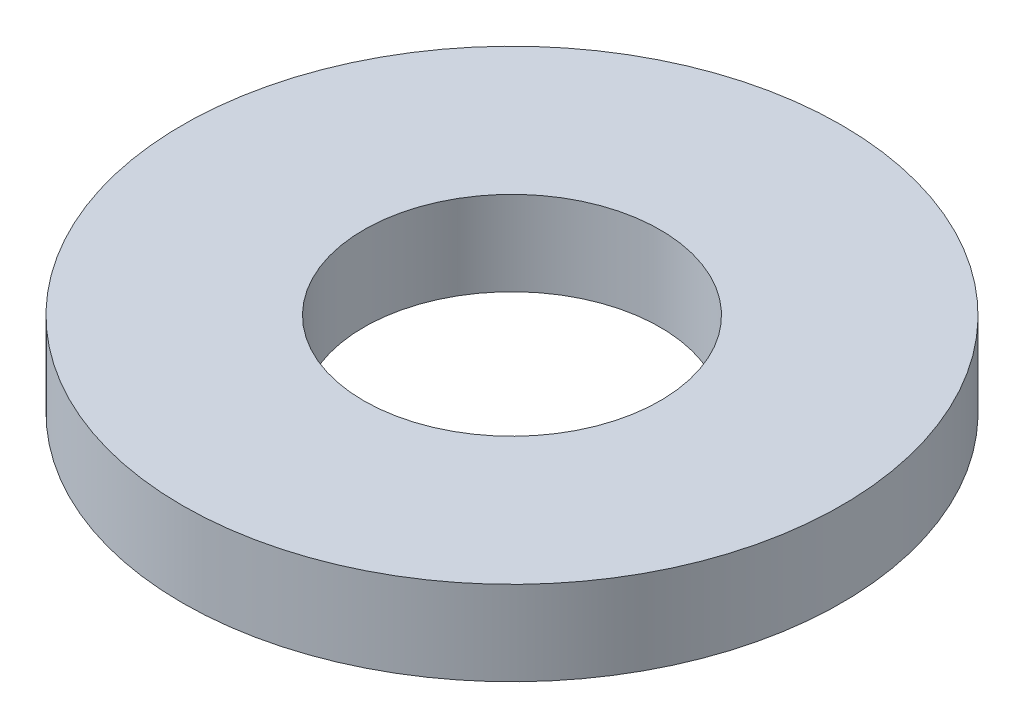
from build123d import *

# Parameters (mm, degrees)
SKETCH1_R           = 7.9375
BOSS_EXTRUDE1_DEPTH = 2.032
SKETCH5_R           = 3.5687
CUT_EXTRUDE1_DEPTH  = 12.40775335


with BuildPart() as part:
    # Sketch1 → Boss-Extrude1 (new body)
    with BuildSketch(Plane(origin=(0, 0, 0), x_dir=(1, 0, 0), z_dir=(0, 1, 0))):
        Circle(SKETCH1_R)
    extrude(amount=BOSS_EXTRUDE1_DEPTH)

    # Sketch5 → Cut-Extrude1 (cut, through all)
    with BuildSketch(Plane(origin=(0, 2.032, 0), x_dir=(-1, 0, 0), z_dir=(0, 1, 0))):
        Circle(SKETCH5_R)
    extrude(amount=-CUT_EXTRUDE1_DEPTH, mode=Mode.SUBTRACT)


solid = part.part
